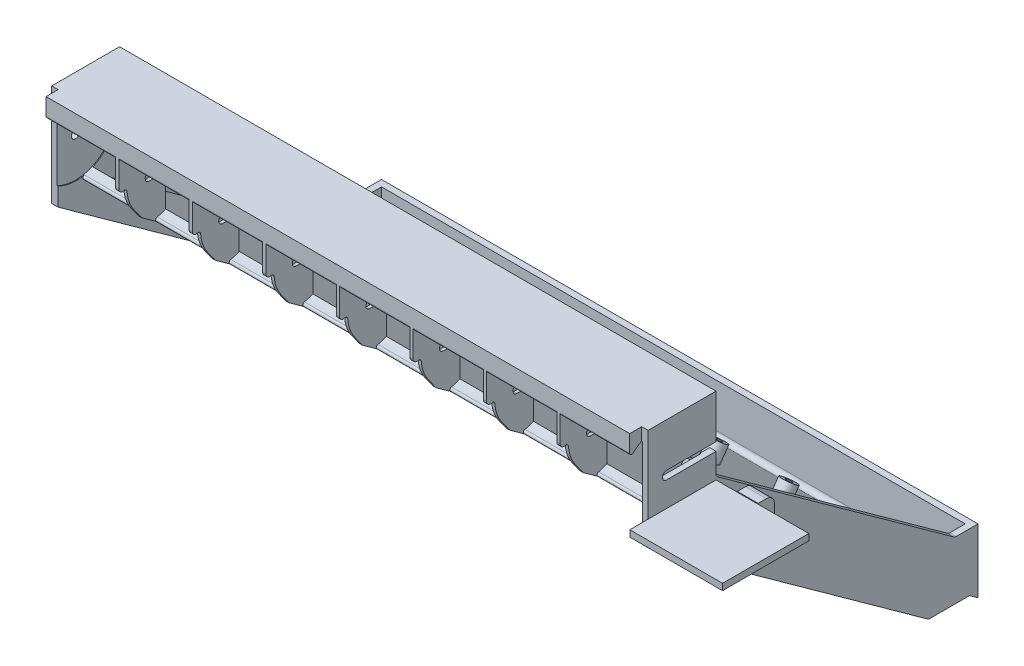
from build123d import *

# Parameters (mm, degrees)
BOSS_EXTRUDE1_DEPTH     = 118.4275
SHELL1_T                = -2.54
SKETCH2_R               = 1.651
CUT_EXTRUDE1_DEPTH      = 300.460156219
BOSS_EXTRUDE2_DEPTH     = 115.8875
CUT_EXTRUDE5_DEPTH      = 2.54
CUT_EXTRUDE2_DEPTH      = 1.905
LPATTERN1_COUNT         = 4
LPATTERN1_PITCH         = 29.21
MIRROR1_COPY_1_DEPTH    = 1.905
MIRROR1_COPY_2_DEPTH    = 1.905
MIRROR1_COPY_3_DEPTH    = 1.905
MIRROR1_COPY_4_DEPTH    = 1.905
FILLET2_R               = 1.5875
BOSS_EXTRUDE4_DEPTH     = 2.54
SKETCH8_W               = 4.7625
SKETCH8_H               = 28.654046999
CUT_EXTRUDE4_DEPTH      = 2.54
CUT_EXTRUDE3_START      = 0.635
SKETCH4_R               = 15.875
CUT_EXTRUDE3_DEPTH      = 27.94
LPATTERN2_COUNT         = 4
LPATTERN2_PITCH         = 29.21
MIRROR2_START           = 0.635
MIRROR2_COPY_1_SKETCH_R = 15.875
MIRROR2_COPY_1_DEPTH    = 27.94
MIRROR2_COPY_2_SKETCH_R = 15.875
MIRROR2_COPY_2_DEPTH    = 27.94
MIRROR2_COPY_3_SKETCH_R = 15.875
MIRROR2_COPY_3_DEPTH    = 27.94
SKETCH6_W               = 34.249499954
SKETCH6_H               = 2.54
BOSS_EXTRUDE3_DEPTH     = 36.83
BOSS_EXTRUDE5_DEPTH     = 2.54
FILLET4_START           = -29.21
FILLET4_DEPTH           = 24.4475
FILLET4_START_2         = 117
FILLET4_2_DEPTH         = 38.2575001
FILLET4_3_DEPTH         = 2.21
FILLET5_R               = 1.5875
FILLET6_R               = 0.79375
SKETCH12_R              = 1.0795
BOSS_EXTRUDE6_DEPTH     = 8.25
CAVITY1_START           = -31.75
CAVITY1_DEPTH           = 2.54
CAVITY1_START_2         = -28.36180931
CAVITY1_2_DEPTH         = 14.101138243
SKETCH13_R              = 3.175
SKETCH13_R_2            = 1.27
BOSS_EXTRUDE7_DEPTH     = 6.35


with BuildPart() as part:
    # Sketch1 → Boss-Extrude1 (new, symmetric)
    with BuildSketch(Plane(origin=(0, 0, 0), x_dir=(0, 0, -1), z_dir=(1, 0, 0))):
        with BuildLine():
            Line((0, 0), (0, -19.05))
            ThreePointArc((0, -19.05), (1.325638398, -24.548212198), (5.011245317, -28.838195435))
            Line((5.011245317, -28.838195435), (135.763, -123.063))
            Line((135.763, -123.063), (135.763, -97.663))
            Line((135.763, -97.663), (126.583553456, -97.663))
            Line((126.583553456, -97.663), (31.75, -29.322249528))
            Line((31.75, -29.322249528), (31.75, 0))
            Line((31.75, 0), (0, 0))
        make_face()
    extrude(amount=BOSS_EXTRUDE1_DEPTH, both=True)

    # Shell1
    shell1_openings = [part.faces().sort_by_distance(p)[0] for p in [
        (0, -14.661124764, -31.75),
        (0, -63.492624764, -79.166776728),
        (0, -97.663, -131.173276728),
    ]]
    offset(amount=SHELL1_T, openings=shell1_openings, kind=Kind.INTERSECTION)

    # Sketch2 → Cut-Extrude1 (cut, through all)
    with BuildSketch(Plane(origin=(118.4275, 0, 0), x_dir=(0, 0, -1), z_dir=(1, 0, 0))):
        with Locations((12.065, -19.05)):
            Circle(SKETCH2_R)
    extrude(amount=-CUT_EXTRUDE1_DEPTH, mode=Mode.SUBTRACT)

    # Sketch5 → Boss-Extrude2 (add, symmetric)
    with BuildSketch(Plane(origin=(0, 0, 0), x_dir=(0, 0, -1), z_dir=(1, 0, 0))):
        with BuildLine():
            Line((2.54, -2.54), (2.54, -19.05))
            ThreePointArc((2.54, -19.05), (3.58655663, -23.390693841), (6.496246303, -26.777522712))
            Line((6.496246303, -26.777522712), (18.62492085, -35.517917758))
            Line((18.62492085, -35.517917758), (18.62492085, -20.6375))
            Line((18.62492085, -20.6375), (12.065, -20.6375))
            ThreePointArc((12.065, -20.6375), (10.4775, -19.05), (12.065, -17.4625))
            Line((12.065, -17.4625), (18.62492085, -17.4625))
            Line((18.62492085, -17.4625), (18.62492085, -2.54))
            Line((18.62492085, -2.54), (2.54, -2.54))
        make_face()
    extrude(amount=BOSS_EXTRUDE2_DEPTH, both=True)

    # Sketch11 → Cut-Extrude5 (cut)
    with BuildSketch(Plane(origin=(118.4275, 0, 0), x_dir=(0, 0, -1), z_dir=(1, 0, 0))):
        with BuildLine():
            Line((12.065, -17.399), (31.75, -17.399))
            Line((31.75, -17.399), (31.75, -20.701))
            Line((31.75, -20.701), (12.065, -20.701))
            ThreePointArc((12.065, -20.701), (10.414, -19.05), (12.065, -17.399))
        make_face()
    extrude(amount=-CUT_EXTRUDE5_DEPTH, mode=Mode.SUBTRACT)

    # Sketch3 → Cut-Extrude2 (cut, symmetric)
    with BuildSketch(Plane(origin=(0, 0, 0), x_dir=(0, 0, -1), z_dir=(1, 0, 0))):
        with BuildLine():
            Line((9.177157915, -31.840314231), (5.011245317, -28.838195435))
            ThreePointArc((5.011245317, -28.838195435), (1.325638398, -24.548212198), (0, -19.05))
            ThreePointArc((0, -19.05), (0.873445893, -19.090768412), (1.741546383, -18.986024302))
            ThreePointArc((1.741546383, -18.986024302), (2.757156563, -18.976368666), (3.303781607, -19.832381708))
            ThreePointArc((3.303781607, -19.832381708), (4.130749465, -23.853564268), (6.040631162, -27.48758916))
            Line((6.040631162, -27.48758916), (9.177157915, -31.840314231))
        make_face()
    cut_extrude2 = extrude(amount=CUT_EXTRUDE2_DEPTH, both=True, mode=Mode.SUBTRACT)

    # LPattern1: Cut-Extrude2 ×4
    with Locations(*[(i * LPATTERN1_PITCH, 0, 0) for i in range(1, LPATTERN1_COUNT)]):
        add(cut_extrude2, mode=Mode.SUBTRACT)

    # Mirror1 copy 1 sketch → Mirror1 copy 1 (cut, symmetric)
    with BuildSketch(Plane(origin=(-29.21, 0, 0), x_dir=(0, 0, -1), z_dir=(-1, 0, 0))):
        with BuildLine():
            Line((9.177157915, 31.840314231), (5.011245317, 28.838195435))
            ThreePointArc((5.011245317, 28.838195435), (1.325638398, 24.548212198), (0, 19.05))
            ThreePointArc((0, 19.05), (0.873445893, 19.090768412), (1.741546383, 18.986024302))
            ThreePointArc((1.741546383, 18.986024302), (2.757156563, 18.976368666), (3.303781607, 19.832381708))
            ThreePointArc((3.303781607, 19.832381708), (4.130749465, 23.853564268), (6.040631162, 27.48758916))
            Line((6.040631162, 27.48758916), (9.177157915, 31.840314231))
        make_face()
    extrude(amount=MIRROR1_COPY_1_DEPTH, both=True, mode=Mode.SUBTRACT)

    # Mirror1 copy 2 sketch → Mirror1 copy 2 (cut, symmetric)
    with BuildSketch(Plane(origin=(-58.42, 0, 0), x_dir=(0, 0, -1), z_dir=(-1, 0, 0))):
        with BuildLine():
            Line((9.177157915, 31.840314231), (5.011245317, 28.838195435))
            ThreePointArc((5.011245317, 28.838195435), (1.325638398, 24.548212198), (0, 19.05))
            ThreePointArc((0, 19.05), (0.873445893, 19.090768412), (1.741546383, 18.986024302))
            ThreePointArc((1.741546383, 18.986024302), (2.757156563, 18.976368666), (3.303781607, 19.832381708))
            ThreePointArc((3.303781607, 19.832381708), (4.130749465, 23.853564268), (6.040631162, 27.48758916))
            Line((6.040631162, 27.48758916), (9.177157915, 31.840314231))
        make_face()
    extrude(amount=MIRROR1_COPY_2_DEPTH, both=True, mode=Mode.SUBTRACT)

    # Mirror1 copy 3 sketch → Mirror1 copy 3 (cut, symmetric)
    with BuildSketch(Plane(origin=(-87.63, 0, 0), x_dir=(0, 0, -1), z_dir=(-1, 0, 0))):
        with BuildLine():
            Line((9.177157915, 31.840314231), (5.011245317, 28.838195435))
            ThreePointArc((5.011245317, 28.838195435), (1.325638398, 24.548212198), (0, 19.05))
            ThreePointArc((0, 19.05), (0.873445893, 19.090768412), (1.741546383, 18.986024302))
            ThreePointArc((1.741546383, 18.986024302), (2.757156563, 18.976368666), (3.303781607, 19.832381708))
            ThreePointArc((3.303781607, 19.832381708), (4.130749465, 23.853564268), (6.040631162, 27.48758916))
            Line((6.040631162, 27.48758916), (9.177157915, 31.840314231))
        make_face()
    extrude(amount=MIRROR1_COPY_3_DEPTH, both=True, mode=Mode.SUBTRACT)

    # Mirror1 copy 4 sketch → Mirror1 copy 4 (cut, symmetric)
    with BuildSketch(Plane(origin=(0, 0, 0), x_dir=(0, 0, -1), z_dir=(-1, 0, 0))):
        with BuildLine():
            Line((9.177157915, 31.840314231), (5.011245317, 28.838195435))
            ThreePointArc((5.011245317, 28.838195435), (1.325638398, 24.548212198), (0, 19.05))
            ThreePointArc((0, 19.05), (0.873445893, 19.090768412), (1.741546383, 18.986024302))
            ThreePointArc((1.741546383, 18.986024302), (2.757156563, 18.976368666), (3.303781607, 19.832381708))
            ThreePointArc((3.303781607, 19.832381708), (4.130749465, 23.853564268), (6.040631162, 27.48758916))
            Line((6.040631162, 27.48758916), (9.177157915, 31.840314231))
        make_face()
    extrude(amount=MIRROR1_COPY_4_DEPTH, both=True, mode=Mode.SUBTRACT)

    # Fillet2
    # the kernel refuses this fillet: 1.5875 mm, written as the material it takes off along each edge
    with BuildSketch(Plane(origin=(1.905, -19.05, 0), x_dir=(0, 1, 0), z_dir=(-1, 0, 0)), Plane(origin=(-85.725, -19.05, 0), x_dir=(0, 1, 0), z_dir=(-1, 0, 0)), Plane(origin=(-56.515, -19.05, 0), x_dir=(0, 1, 0), z_dir=(-1, 0, 0)), Plane(origin=(-27.305, -19.05, 0), x_dir=(0, 1, 0), z_dir=(-1, 0, 0)), Plane(origin=(89.535, -19.05, 0), x_dir=(0, 1, 0), z_dir=(-1, 0, 0)), Plane(origin=(60.325, -19.05, 0), x_dir=(0, 1, 0), z_dir=(-1, 0, 0)), Plane(origin=(31.115, -19.05, 0), x_dir=(0, 1, 0), z_dir=(-1, 0, 0))) as fillet2_piece_1:
        with BuildLine():
            CenterArc((1.643983914, 1.5875), FILLET2_R, 174.43142161, 95.56857839)
            Line((0.063975698, 1.741546383), (0.032375534, 1.744627311))
            ThreePointArc((0.032375534, 1.744627311), (-0.072497011, 0.874611443), (-0.031482084, -0.004115932))
            Line((-0.031482084, -0.004115932), (0, -0.03175))
            Line((0, -0.03175), (1.643983914, -0.03175))
            Line((1.643983914, -0.03175), (1.643983914, 0))
        make_face()
    extrude(amount=3.81, mode=Mode.SUBTRACT)

    # Sketch7 → Boss-Extrude4 (add)
    with BuildSketch(Plane(origin=(118.4275, 0, 0), x_dir=(0, 0, -1), z_dir=(1, 0, 0))):
        with BuildLine():
            Line((4.7625, -28.654046999), (4.7625, -40.399523292))
            Line((4.7625, -40.399523292), (116.122674129, -120.65))
            Line((116.122674129, -120.65), (132.414582505, -120.65))
            Line((132.414582505, -120.65), (5.011245317, -28.838195435))
            ThreePointArc((5.011245317, -28.838195435), (4.886282162, -28.746918851), (4.7625, -28.654046999))
        make_face()
    boss_extrude4 = extrude(amount=-BOSS_EXTRUDE4_DEPTH)

    # Sketch8 → Cut-Extrude4 (cut)
    with BuildSketch(Plane(origin=(118.4275, 0, 0), x_dir=(0, 0, -1), z_dir=(1, 0, 0))):
        with Locations((2.38125, -14.3270235)):
            Rectangle(SKETCH8_W, SKETCH8_H)
    cut_extrude4 = extrude(amount=-CUT_EXTRUDE4_DEPTH, mode=Mode.SUBTRACT)

    # Mirror4: Boss-Extrude4, Cut-Extrude4 across plane
    add(boss_extrude4.mirror(Plane(origin=(0, 0, 0), x_dir=(0, 0, 1), z_dir=(1, 0, 0))))
    add(cut_extrude4.mirror(Plane(origin=(0, 0, 0), x_dir=(0, 0, 1), z_dir=(1, 0, 0))), mode=Mode.SUBTRACT)

    # Sketch4 → Cut-Extrude3 (cut)
    with BuildSketch(Plane(origin=(0, 0, 0), x_dir=(0, 0, -1), z_dir=(1, 0, 0)).offset(CUT_EXTRUDE3_START)):
        with Locations((12.065, -19.05)):
            Circle(SKETCH4_R)
    cut_extrude3 = extrude(amount=CUT_EXTRUDE3_DEPTH, mode=Mode.SUBTRACT)

    # LPattern2: Cut-Extrude3 ×4
    with Locations(*[(i * LPATTERN2_PITCH, 0, 0) for i in range(1, LPATTERN2_COUNT)]):
        add(cut_extrude3, mode=Mode.SUBTRACT)

    # Mirror2: Cut-Extrude3 across plane
    add(cut_extrude3.mirror(Plane(origin=(0, 0, 0), x_dir=(0, 0, 1), z_dir=(1, 0, 0))), mode=Mode.SUBTRACT)

    # Mirror2 copy 1 sketch → Mirror2 copy 1 (cut)
    with BuildSketch(Plane(origin=(-29.21, 0, 0), x_dir=(0, 0, -1), z_dir=(-1, 0, 0)).offset(MIRROR2_START)):
        with Locations((12.065, 19.05)):
            Circle(MIRROR2_COPY_1_SKETCH_R)
    extrude(amount=MIRROR2_COPY_1_DEPTH, mode=Mode.SUBTRACT)

    # Mirror2 copy 2 sketch → Mirror2 copy 2 (cut)
    with BuildSketch(Plane(origin=(-58.42, 0, 0), x_dir=(0, 0, -1), z_dir=(-1, 0, 0)).offset(MIRROR2_START)):
        with Locations((12.065, 19.05)):
            Circle(MIRROR2_COPY_2_SKETCH_R)
    extrude(amount=MIRROR2_COPY_2_DEPTH, mode=Mode.SUBTRACT)

    # Mirror2 copy 3 sketch → Mirror2 copy 3 (cut)
    with BuildSketch(Plane(origin=(-87.63, 0, 0), x_dir=(0, 0, -1), z_dir=(-1, 0, 0)).offset(MIRROR2_START)):
        with Locations((12.065, 19.05)):
            Circle(MIRROR2_COPY_3_SKETCH_R)
    extrude(amount=MIRROR2_COPY_3_DEPTH, mode=Mode.SUBTRACT)

    # Sketch6 → Boss-Extrude3 (add)
    with BuildSketch(Plane(origin=(118.4275, 0, 0), x_dir=(0, 0, -1), z_dir=(1, 0, 0))):
        with Locations((14.625250023, -31.82)):
            Rectangle(SKETCH6_W, SKETCH6_H)
    extrude(amount=BOSS_EXTRUDE3_DEPTH)

    # Sketch10 → Boss-Extrude5 (add)
    with BuildSketch(Plane(origin=(0, 0, -31.75), x_dir=(-1, 0, 0), z_dir=(0, 0, -1))):
        with BuildLine():
            Line((-155.2575, -33.09), (-118.4275, -33.09))
            Line((-118.4275, -33.09), (-118.4275, -56.874455815))
            add(Edge.make_bspline(
                [(-118.4275, -56.874455815), (-128.143255962, -33.251560567), (-155.2575, -33.09)],
                knots=[0, 0, 0, 1, 1, 1], degree=2))
        make_face()
    extrude(amount=-BOSS_EXTRUDE5_DEPTH)

    # Fillet4: read off the stored shape, not the designer's step
    # Fillet4 outline → Fillet4 (add)
    with BuildSketch(Plane.XY.offset(FILLET4_START)):
        with BuildLine():
            ThreePointArc((118.4275, -34.6775), (118.892467985, -33.554967985), (120.015, -33.09))
            Line((120.015, -33.09), (118.4275, -33.09))
            Line((118.4275, -33.09), (118.4275, -34.6775))
        make_face()
    extrude(amount=FILLET4_DEPTH)

    # Fillet4 2 outline → Fillet4 2 (add)
    with BuildSketch(Plane.YZ.offset(FILLET4_START_2)):
        with BuildLine():
            ThreePointArc((-33.09, -27.6225), (-33.554967985, -28.745032015), (-34.6775, -29.21))
            Line((-34.6775, -29.21), (-33.09, -29.21))
            Line((-33.09, -29.21), (-33.09, -27.6225))
        make_face()
    extrude(amount=FILLET4_2_DEPTH)

    # Fillet4 3 outline → Fillet4 3 (cut)
    with BuildSketch(Plane.XY.offset(FILLET4_START)):
        with BuildLine():
            Line((155.2575001, -34.6775), (155.2575, -33.09))
            add(Edge.make_bspline(
                [(155.2575, -33.09), (148.388677375, -33.130927967), (142.6364123, -34.6775)],
                knots=[0, 0, 0, 0.253328937, 0.253328937, 0.253328937], degree=2))
            Line((142.6364123, -34.6775), (155.2575001, -34.6775))
        make_face()
    extrude(amount=FILLET4_3_DEPTH, mode=Mode.SUBTRACT)

    # Fillet5
    fillet5_edges = [part.edges().sort_by_distance(p)[0] for p in [
        (117.1575, -29.322249528, -31.75),
        (117.1575, -97.663, -126.583553456),
        (-117.1575, -29.322249528, -31.75),
        (-117.1575, -97.663, -126.583553456),
        (0, -2.54, -31.75),
        (0, -118.101754874, -133.223),
        (0, -2.54, -18.62492085),
        (0, -35.517917758, -18.62492085),
    ]]
    fillet(fillet5_edges, radius=FILLET5_R)

    # Fillet6
    fillet6_edges = [part.edges().sort_by_distance(p)[0] for p in [
        (14.605, -8.732471226, 0),
        (14.605, -34.870297955, -13.381737488),
        (43.815, -8.732471226, 0),
        (43.815, -34.870297955, -13.381737488),
        (73.025, -8.732471226, 0),
        (73.025, -34.870297955, -13.381737488),
        (102.07625, -34.870297955, -13.381737488),
        (102.07625, -8.732471226, 0),
        (-14.605, -8.732471226, 0),
        (-14.605, -34.870297955, -13.381737488),
        (-43.815, -8.732471226, 0),
        (-43.815, -34.870297955, -13.381737488),
        (-73.025, -8.732471226, 0),
        (-73.025, -34.870297955, -13.381737488),
        (-102.07625, -34.870297955, -13.381737488),
        (-102.07625, -8.732471226, 0),
    ]]
    fillet(fillet6_edges, radius=FILLET6_R)

    # Sketch12 → Boss-Extrude6 (add)
    with BuildSketch(Plane(origin=(118.4275, 0, 0), x_dir=(0, 0, -1), z_dir=(1, 0, 0))):
        with BuildLine():
            Line((43.476785522, -38.715450877), (40.215782665, -38.715450877))
            Line((40.215782665, -38.715450877), (40.215782665, -59.215450877))
            Line((40.215782665, -59.215450877), (46.651785522, -59.215450877))
            Line((46.651785522, -59.215450877), (46.651785522, -41.890450877))
            ThreePointArc((46.651785522, -41.890450877), (45.721849552, -39.645386847), (43.476785522, -38.715450877))
        make_face()
        with Locations((43.176785522, -43.965450877)):
            Circle(SKETCH12_R, mode=Mode.SUBTRACT)
        with Locations((43.176785522, -53.965450877)):
            Circle(SKETCH12_R, mode=Mode.SUBTRACT)
    extrude(amount=BOSS_EXTRUDE6_DEPTH)

    # Cavity1: read off the stored shape, not the designer's step
    # Cavity1 outline → Cavity1 (cut)
    with BuildSketch(Plane.XY.offset(CAVITY1_START)):
        with BuildLine():
            Line((118.4275, -38.900474566), (118.4275, -56.874455815))
            add(Edge.make_bspline(
                [(133.130347142, -38.715450877), (123.45218942, -44.657422752), (118.4275, -56.874455815)],
                knots=[0.482830833, 0.482830833, 0.482830833, 1, 1, 1], degree=2))
            Line((133.130347142, -38.715450877), (129.0275, -38.715450877))
            Line((129.0275, -38.715450877), (118.4275, -38.900474566))
        make_face()
    extrude(amount=CAVITY1_DEPTH, mode=Mode.SUBTRACT)

    # Cavity1 2 outline → Cavity1 2 (cut)
    with BuildSketch(Plane.XY.offset(CAVITY1_START_2)):
        Polygon((116.5275, -49.956347412), (118.4275, -50.465450877), (118.4275, -47.465450877), (116.5275, -47.974554343), align=None)
    extrude(amount=CAVITY1_2_DEPTH, mode=Mode.SUBTRACT)

    # Cavity1 3 outline → Cavity1 3 (revolve, cut)
    with BuildSketch(Plane(origin=(0, -48.965450877, -8.26180921), x_dir=(0, 1, 0), z_dir=(0, 0, -1))):
        Polygon((4.903580983, 118.427500004), (4.903580983, 116.527498789), (6.240896534, 116.5275), (6.750000001, 118.427500004), align=None)
    revolve(axis=Axis((0, -48.965450877, -8.26180921), (1, 0, 0)), mode=Mode.SUBTRACT)

    # Cavity1 4 outline → Cavity1 4 (revolve, cut)
    with BuildSketch(Plane(origin=(0, -48.965450877, -18.86180921), x_dir=(0, 1, 0), z_dir=(0, 0, -1))):
        Polygon((0, 116.5275), (2.365896534, 116.5275), (2.875, 118.4275), (0, 118.4275), align=None)
    revolve(axis=Axis((0, -48.965450877, -18.86180921), (1, 0, 0)), mode=Mode.SUBTRACT)

    # Cavity1 5 outline → Cavity1 5 (revolve, cut)
    with BuildSketch(Plane(origin=(0, -48.965450877, -28.36180921), x_dir=(0, 1, 0), z_dir=(0, 0, -1))):
        Polygon((1.5, 118.4275), (0, 118.4275), (0, 116.5275), (0.990896534, 116.5275), align=None)
    revolve(axis=Axis((0, -48.965450877, -28.36180921), (1, 0, 0)), mode=Mode.SUBTRACT)

    # Sketch13 → Boss-Extrude7 (add)
    # profile 1 of 4: a face of its own
    with BuildSketch(Plane(origin=(0, -14.543393054, 10.480535206), x_dir=(1, 0, 0), z_dir=(0, 0.8112884736788525, -0.5846460574363245))):
        with Locations(Location((77.7875, 87.488343796, 0), (0, 0, 270))):
            Circle(SKETCH13_R)
        with Locations(Location((77.7875, 87.488343796, 0), (0, 0, 270))):
            Circle(SKETCH13_R_2, mode=Mode.SUBTRACT)
    # profile 2 of 4: a face of its own
    with BuildSketch(Plane(origin=(0, -14.543393054, 10.480535206), x_dir=(1, 0, 0), z_dir=(0, 0.8112884736788525, -0.5846460574363245))):
        with Locations(Location((29.5275, 88.758343796, 0), (0, 0, 270))):
            Circle(SKETCH13_R)
        with Locations(Location((29.5275, 88.758343796, 0), (0, 0, 270))):
            Circle(SKETCH13_R_2, mode=Mode.SUBTRACT)
    # profile 3 of 4: a face of its own
    with BuildSketch(Plane(origin=(0, -14.543393054, 10.480535206), x_dir=(1, 0, 0), z_dir=(0, 0.8112884736788525, -0.5846460574363245))):
        with Locations(Location((72.7075, 139.558343796, 0), (0, 0, 270))):
            Circle(SKETCH13_R)
        with Locations(Location((72.7075, 139.558343796, 0), (0, 0, 270))):
            Circle(SKETCH13_R_2, mode=Mode.SUBTRACT)
    # profile 4 of 4: a face of its own
    with BuildSketch(Plane(origin=(0, -14.543393054, 10.480535206), x_dir=(1, 0, 0), z_dir=(0, 0.8112884736788525, -0.5846460574363245))):
        with Locations(Location((44.7675, 139.558343796, 0), (0, 0, 270))):
            Circle(SKETCH13_R)
        with Locations(Location((44.7675, 139.558343796, 0), (0, 0, 270))):
            Circle(SKETCH13_R_2, mode=Mode.SUBTRACT)
    extrude(amount=BOSS_EXTRUDE7_DEPTH)


solid = part.part
